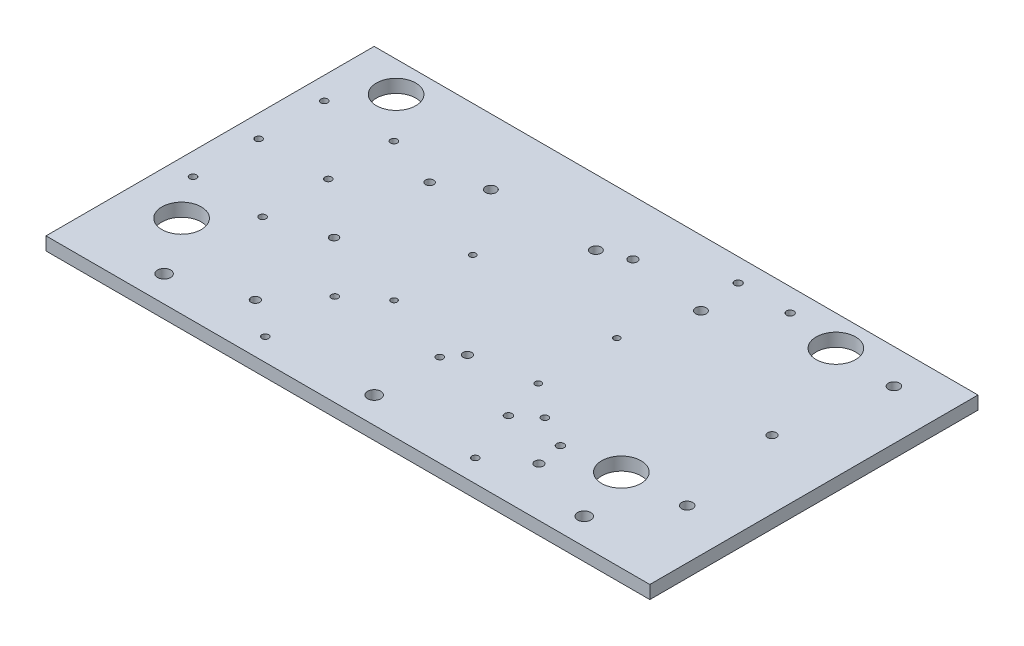
from build123d import *

# Parameters (mm, degrees)
SKETCH1_W           = 292.1
SKETCH1_H           = 158.75
BOSS_EXTRUDE1_DEPTH = 6.35
SKETCH2_R           = 3.175
CUT_EXTRUDE2_DEPTH  = 6.35
SKETCH6_R           = 9.525
CUT_EXTRUDE3_DEPTH  = 333.512097524
SKETCH8_R           = 2.667
SKETCH8_R_2         = 2.54
SKETCH8_R_3         = 1.5
SKETCH8_R_4         = 1.651
SKETCH8_R_5         = 2.0955
SKETCH8_R_6         = 1.7907
SKETCH8_R_7         = 1.9685
CUT_EXTRUDE4_DEPTH  = 333.512097524


with BuildPart() as part:
    # Sketch1 → Boss-Extrude1 (new body)
    with BuildSketch(Plane(origin=(0, 0, 0), x_dir=(1, 0, 0), z_dir=(0, 1, 0))):
        with Locations((146.05, 79.375)):
            Rectangle(SKETCH1_W, SKETCH1_H)
    extrude(amount=BOSS_EXTRUDE1_DEPTH)

    # Sketch2 → Cut-Extrude2 (cut)
    with BuildSketch(Plane(origin=(0, 6.35, 0), x_dir=(1, 0, 0), z_dir=(0, 1, 0))):
        with Locations((146.05, 12.7)):
            Circle(SKETCH2_R)
        with Locations((247.65, 12.7)):
            Circle(SKETCH2_R)
        with Locations((44.45, 12.7)):
            Circle(SKETCH2_R)
    extrude(amount=-CUT_EXTRUDE2_DEPTH, mode=Mode.SUBTRACT)

    # Sketch6 → Cut-Extrude3 (cut, through all)
    with BuildSketch(Plane(origin=(0, 6.35, 0), x_dir=(1, 0, 0), z_dir=(0, 1, 0))):
        with Locations((25.4, 40.187936889)):
            Circle(SKETCH6_R)
        with Locations((238.125, 40.187936889)):
            Circle(SKETCH6_R)
        with Locations((25.4, 143.962063111)):
            Circle(SKETCH6_R)
        with Locations((238.125, 143.962063111)):
            Circle(SKETCH6_R)
    extrude(amount=-CUT_EXTRUDE3_DEPTH, mode=Mode.SUBTRACT)

    # Sketch8 → Cut-Extrude4 (cut, through all)
    with BuildSketch(Plane(origin=(0, 6.35, 0), x_dir=(1, 0, 0), z_dir=(0, 1, 0))):
        with Locations((268.097, 42.075)):
            Circle(SKETCH8_R)
        with Locations((268.097, 142.075)):
            Circle(SKETCH8_R)
        with Locations((189.8015, 127)):
            Circle(SKETCH8_R_2)
        with Locations((139.0015, 127)):
            Circle(SKETCH8_R_2)
        with Locations((88.2015, 127)):
            Circle(SKETCH8_R_2)
        with Locations((111.2, 57.2)):
            Circle(SKETCH8_R_3)
        with Locations((180.9, 57.2)):
            Circle(SKETCH8_R_3)
        with Locations((180.9, 95.2)):
            Circle(SKETCH8_R_3)
        with Locations((111.2, 95.2)):
            Circle(SKETCH8_R_3)
        with Locations((95.25, 10.795)):
            Circle(SKETCH8_R_4)
        with Locations((196.85, 10.795)):
            Circle(SKETCH8_R_4)
        with Locations((196.85, 44.45)):
            Circle(SKETCH8_R_4)
        with Locations((95.25, 44.45)):
            Circle(SKETCH8_R_4)
        with Locations((10.795, 123.825)):
            Circle(SKETCH8_R_4)
        with Locations((10.795, 60.325)):
            Circle(SKETCH8_R_4)
        with Locations((44.45, 60.325)):
            Circle(SKETCH8_R_4)
        with Locations((44.45, 123.825)):
            Circle(SKETCH8_R_4)
        with Locations((77.450977137, 23.8125)):
            Circle(SKETCH8_R_5)
        with Locations((151.8, 132.099022863)):
            Circle(SKETCH8_R_5)
        with Locations((214.649022863, 23.8125)):
            Circle(SKETCH8_R_5)
        with Locations((151.8, 52.050977137)):
            Circle(SKETCH8_R_5)
        with Locations((259.099022863, 92.075)):
            Circle(SKETCH8_R_5)
        with Locations((187.1695, 36.5252)):
            Circle(SKETCH8_R_6)
        with Locations((212.3155, 36.5252)):
            Circle(SKETCH8_R_6)
        with Locations((212.3155, 147.6248)):
            Circle(SKETCH8_R_6)
        with Locations((187.1695, 147.6248)):
            Circle(SKETCH8_R_6)
        with Locations((70.3882, 115.2108)):
            Circle(SKETCH8_R_7)
        with Locations((70.3882, 68.9392)):
            Circle(SKETCH8_R_7)
        with Locations((44.45, 92.075)):
            Circle(SKETCH8_R_4)
        with Locations((10.795, 92.075)):
            Circle(SKETCH8_R_4)
        with Locations((146.05, 44.45)):
            Circle(SKETCH8_R_4)
    extrude(amount=-CUT_EXTRUDE4_DEPTH, mode=Mode.SUBTRACT)


solid = part.part
